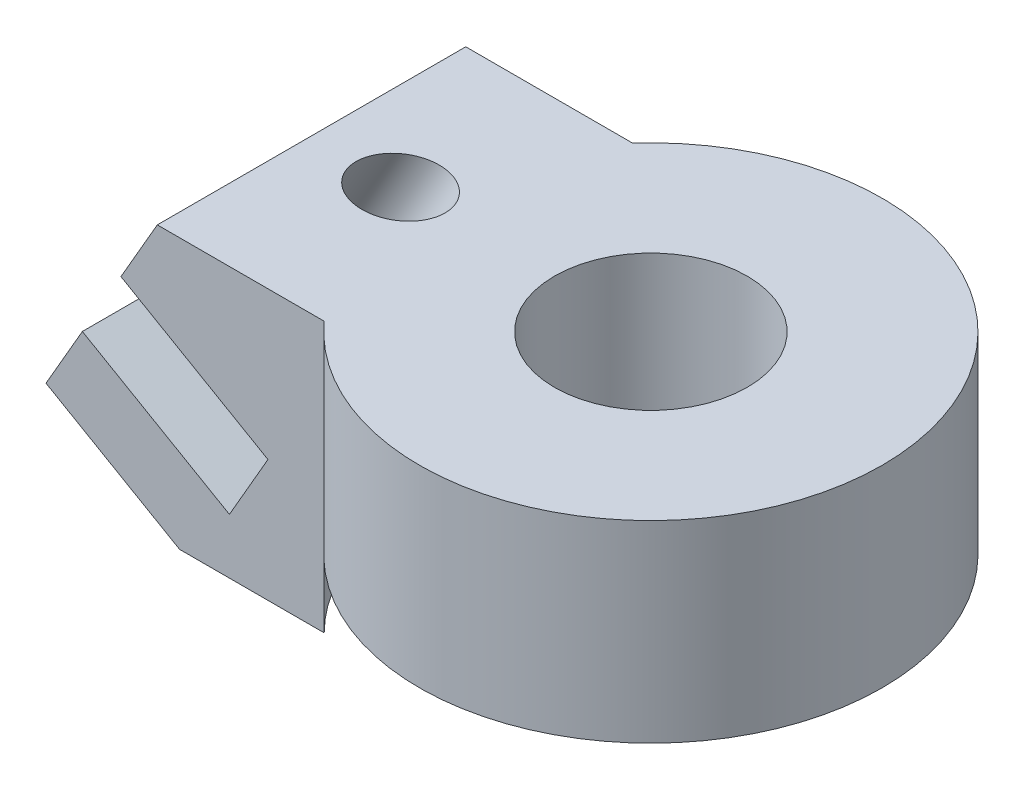
from build123d import *

# Parameters (mm, degrees)
SKETCH_2_R               = 6
EXTRUDE_1_DEPTH          = 5
SKETCH_3_R               = 2.5
CUT_EXTRUDE_1_DEPTH      = 5
SKETCH_4_W               = 8.617209121
SKETCH_4_H               = 5
EXTRUDE_2_DEPTH          = 4
SKETCH_5_W               = 17.690730237
SKETCH_5_H               = 8.258947269
CUT_EXTRUDE_3_DEPTH      = 4.5
EXTRUDE_5_DEPTH          = 2
CUT_EXTRUDE_7_DEPTH      = 1
CUT_EXTRUDE_7_DEPTH_BACK = 1
SKETCH_10_W              = 4.403388768
SKETCH_10_H              = 8
CUT_EXTRUDE_8_DEPTH      = 4
SKETCH_15_R              = 1
CUT_EXTRUDE_9_DEPTH      = 8


with BuildPart() as part:
    # 草图2 → 凸台-拉伸1 (new body)
    with BuildSketch(Plane(origin=(0, 0, 0), x_dir=(1, 0, 0), z_dir=(0, 1, 0))):
        with Locations(Location((0, 0, 0), (0, 0, 270))):
            Circle(SKETCH_2_R)
    extrude(amount=EXTRUDE_1_DEPTH)

    # 草图3 → 切除-拉伸1 (cut)
    with BuildSketch(Plane(origin=(0, 5, 0), x_dir=(1, 0, 0), z_dir=(0, 1, 0))):
        with Locations(Location((0, 0, 0), (0, 0, 270))):
            Circle(SKETCH_3_R)
    extrude(amount=-CUT_EXTRUDE_1_DEPTH, mode=Mode.SUBTRACT)

    # 草图4 → 凸台-拉伸2 (add, symmetric)
    with BuildSketch(Plane.XY):
        with Locations((-7.378700456, 2.5)):
            Rectangle(SKETCH_4_W, SKETCH_4_H)
    extrude(amount=EXTRUDE_2_DEPTH, both=True)

    # 草图5 → 切除-拉伸3 (cut)
    with BuildSketch(Plane(origin=(-8.765478763, 5.060751523, 0), x_dir=(0, 0, 1), z_dir=(0.8660254037844398, -0.499999999999998, 0))):
        with Locations((1.152187915, 4.129473635)):
            Rectangle(SKETCH_5_W, SKETCH_5_H)
    extrude(amount=-CUT_EXTRUDE_3_DEPTH, mode=Mode.SUBTRACT)

    # 草图12 → 凸台-拉伸5 (add)
    with BuildSketch(Plane.XZ):
        with BuildLine():
            Line((-11.687305017, 4), (-4.472135955, 4))
            ThreePointArc((-4.472135955, 4), (-6.128990204, 0), (-4.472135955, -4))
            Line((-4.472135955, -4), (-11.687305017, -4))
            Line((-11.687305017, -4), (-11.687305017, 4))
        make_face()
    extrude(amount=EXTRUDE_5_DEPTH)

    # 草图10 → 切除-拉伸7 (cut, two sides: drawn at the far end of the back side and taken through both)
    with BuildSketch(Plane(origin=(-1.478450581, -2.560751523, 0), x_dir=(0.8660254037844398, -0.49999999999999806, 0), z_dir=(0.499999999999998, 0.8660254037844397, 0)).offset(-CUT_EXTRUDE_7_DEPTH_BACK)):
        with Locations((-7.919808662, 0)):
            Rectangle(SKETCH_10_W, SKETCH_10_H)
    extrude(amount=CUT_EXTRUDE_7_DEPTH + CUT_EXTRUDE_7_DEPTH_BACK, mode=Mode.SUBTRACT)

    # 草图14 → 切除-拉伸8 (cut)
    with BuildSketch(Plane(origin=(-2.921826254, -5.060751523, 0), x_dir=(0.8660254037844398, -0.499999999999998, 0), z_dir=(0.49999999999999806, 0.8660254037844399, 0))):
        Polygon((-9.121503046, 4), (-5.535941973, 4), (-5.535941973, -4), (-9.121503046, -4), (-10.121503046, -4), (-10.121503046, 4), align=None)
    extrude(amount=-CUT_EXTRUDE_8_DEPTH, mode=Mode.SUBTRACT)

    # 草图15 → 切除-拉伸9 (cut)
    with BuildSketch(Plane(origin=(-2.921826254, -5.060751523, 0), x_dir=(0.8660254037844397, -0.4999999999999983, 0), z_dir=(-0.4999999999999982, -0.8660254037844396, 0))):
        with Locations((-8.121503046, 0)):
            Circle(SKETCH_15_R)
    extrude(amount=-CUT_EXTRUDE_9_DEPTH, mode=Mode.SUBTRACT)


solid = part.part
